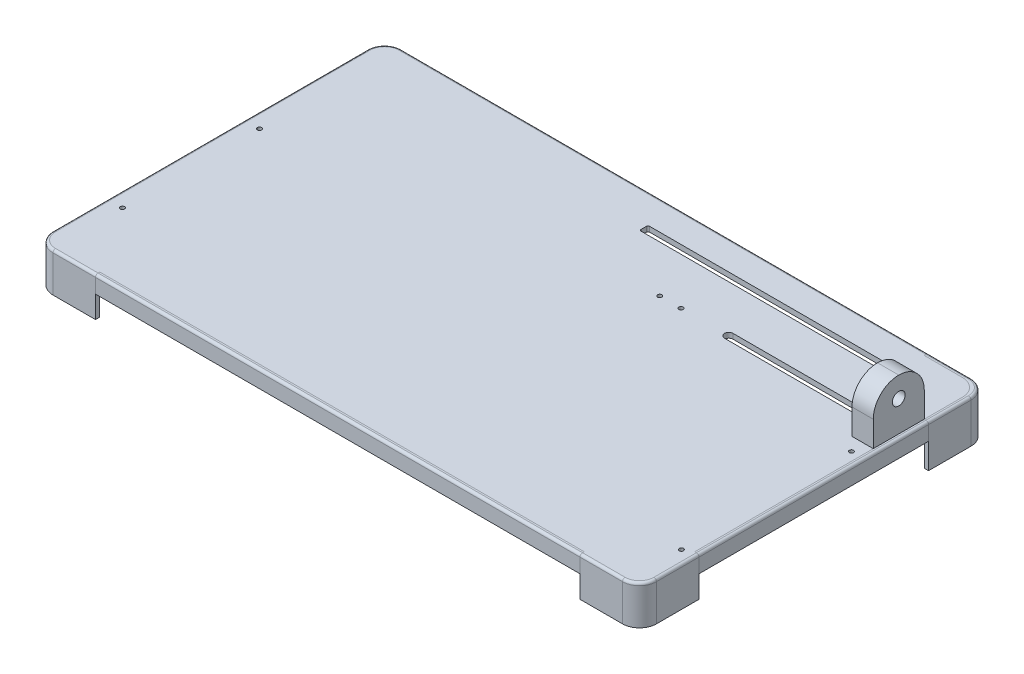
from build123d import *

# Parameters (mm, degrees)
SKETCH1_W                         = 700
SKETCH1_H                         = 400
BOSS_EXTRUDE1_DEPTH               = 6
SKETCH3_W                         = 310
SKETCH3_H                         = 10
CUT_EXTRUDE1_DEPTH                = 26
FILLET1_R                         = 2
FILLET2_R                         = 20
BOSS_EXTRUDE2_START               = -6
BOSS_EXTRUDE2_DEPTH               = 46
BOSS_EXTRUDE3_DEPTH               = 50
SKETCH10_W                        = 570
SKETCH10_H                        = 5
BOSS_EXTRUDE4_DEPTH               = 20
SKETCH11_W                        = 5
SKETCH11_H                        = 270
BOSS_EXTRUDE5_DEPTH               = 20
LPATTERN1_COUNT                   = 2
LPATTERN1_PITCH                   = 405
LPATTERN2_COUNT                   = 2
LPATTERN2_PITCH                   = 705
FILLET3_R                         = 3
FILLET4_R                         = 3
FILLET5_R                         = 3
FILLET6_R                         = 3
FILLET7_R                         = 3
F_5_0_5_DIAMETER_HOLE1_AT_2_COUNT = 2
F_5_0_5_DIAMETER_HOLE1_AT_2_PITCH = 25
SKETCH14_W                        = 25
SKETCH14_H                        = 60
BOSS_EXTRUDE6_DEPTH               = 60
FILLET8_R                         = 30
CUT_EXTRUDE2_DEPTH                = 60
SKETCH16_R                        = 7.5
CUT_EXTRUDE3_DEPTH                = 40
F_5_0_5_DIAMETER_HOLE2_AT_2_COUNT = 2
F_5_0_5_DIAMETER_HOLE2_AT_2_PITCH = 200
F_5_0_5_DIAMETER_HOLE3_AT_2_COUNT = 2
F_5_0_5_DIAMETER_HOLE3_AT_2_PITCH = 161.29


with BuildPart() as part:
    # Sketch1 → Boss-Extrude1 (new body)
    with BuildSketch(Plane(origin=(0, 0, 0), x_dir=(1, 0, 0), z_dir=(0, 1, 0))):
        Rectangle(SKETCH1_W, SKETCH1_H)
    extrude(amount=BOSS_EXTRUDE1_DEPTH)

    # Sketch3 → Cut-Extrude1 (cut)
    with BuildSketch(Plane(origin=(0, 6, 0), x_dir=(-1, 0, 0), z_dir=(0, 1, 0))):
        with Locations((-145, -165)):
            Rectangle(SKETCH3_W, SKETCH3_H)
    extrude(amount=-CUT_EXTRUDE1_DEPTH, mode=Mode.SUBTRACT)

    # Fillet1
    fillet1_edges = [part.edges().sort_by_distance(p)[0] for p in [
        (-10, 3, -160),
        (-10, 3, -170),
        (300, 3, -170),
        (300, 3, -160),
    ]]
    fillet(fillet1_edges, radius=FILLET1_R)

    # Fillet2
    fillet2_edges = [part.edges().sort_by_distance(p)[0] for p in [
        (-350, 3, -200),
        (350, 3, -200),
        (350, 3, 200),
        (-350, 3, 200),
    ]]
    fillet(fillet2_edges, radius=FILLET2_R)


with BuildPart() as body_2:
    # Sketch8 → Boss-Extrude2 (new body)
    with BuildSketch(Plane.XZ.offset(BOSS_EXTRUDE2_START)):
        with BuildLine():
            Line((-355, 135), (-355, 185))
            ThreePointArc((-355, 185), (-349.142135624, 199.142135624), (-335, 205))
            Line((-335, 205), (-285, 205))
            Line((-285, 205), (-285, 200))
            Line((-285, 200), (-330, 200))
            ThreePointArc((-330, 200), (-344.142135624, 194.142135624), (-350, 180))
            Line((-350, 180), (-350, 135))
            Line((-350, 135), (-355, 135))
        make_face()
    boss_extrude2 = extrude(amount=BOSS_EXTRUDE2_DEPTH)


with BuildPart() as part_1:
    add(part.part)

    # Mirror3: Boss-Extrude2 across plane
    add(boss_extrude2.mirror(Plane.XY))

    # Mirror6: Boss-Extrude2 across plane
    add(boss_extrude2.mirror(Plane(origin=(0, 0, 0), x_dir=(0, 0, 1), z_dir=(1, 0, 0))))


with BuildPart() as body_3:
    # Sketch9 → Boss-Extrude3 (new body)
    with BuildSketch(Plane(origin=(0, 6, 0), x_dir=(-1, 0, 0), z_dir=(0, 1, 0))):
        with BuildLine():
            Line((-355, -135), (-355, -185))
            ThreePointArc((-355, -185), (-349.142135624, -199.142135624), (-335, -205))
            Line((-335, -205), (-285, -205))
            Line((-285, -205), (-285, -200))
            Line((-285, -200), (-330, -200))
            ThreePointArc((-330, -200), (-344.142135624, -194.142135624), (-350, -180))
            Line((-350, -180), (-350, -135))
            Line((-350, -135), (-355, -135))
        make_face()
    extrude(amount=-BOSS_EXTRUDE3_DEPTH)

    # Fillet6
    fillet6_edges = [body_3.edges().sort_by_distance(p)[0] for p in [
        (355, 6, -160),
        (310, 6, -205),
        (349.142135624, 6, -199.142135624),
    ]]
    fillet(fillet6_edges, radius=FILLET6_R)


with BuildPart() as body_4:
    # Sketch10 → Boss-Extrude4 (new body)
    with BuildSketch(Plane(origin=(0, 6, 0), x_dir=(-1, 0, 0), z_dir=(0, 1, 0))):
        with Locations((0, 202.5)):
            Rectangle(SKETCH10_W, SKETCH10_H)
    boss_extrude4 = extrude(amount=-BOSS_EXTRUDE4_DEPTH)

    # Fillet3
    fillet3_edges = [body_4.edges().sort_by_distance(p)[0] for p in [
        (0, 6, 205),
    ]]
    fillet(fillet3_edges, radius=FILLET3_R)


with BuildPart() as body_5:
    # Sketch11 → Boss-Extrude5 (new body)
    with BuildSketch(Plane(origin=(0, 6, 0), x_dir=(-1, 0, 0), z_dir=(0, 1, 0))):
        with Locations((-352.5, 0)):
            Rectangle(SKETCH11_W, SKETCH11_H)
    boss_extrude5 = extrude(amount=-BOSS_EXTRUDE5_DEPTH)

    # Fillet4
    fillet4_edges = [body_5.edges().sort_by_distance(p)[0] for p in [
        (355, 6, 0),
    ]]
    fillet(fillet4_edges, radius=FILLET4_R)


with BuildPart() as part_2:
    add(part_1.part)

    # LPattern1: Boss-Extrude4 ×2
    with Locations(*[(0, 0, -i * LPATTERN1_PITCH) for i in range(1, LPATTERN1_COUNT)]):
        add(boss_extrude4)

    add(body_2.part)  # LPattern2 merges body 2
    # LPattern2: Boss-Extrude5 ×2
    with Locations(*[(-i * LPATTERN2_PITCH, 0, 0) for i in range(1, LPATTERN2_COUNT)]):
        add(boss_extrude5)

    # Fillet5
    fillet5_edges = [part_2.edges().sort_by_distance(p)[0] for p in [
        (310, 6, 205),
        (349.142135624, 6, 199.142135624),
        (355, 6, 160),
    ]]
    fillet(fillet5_edges, radius=FILLET5_R)

    # Fillet7
    fillet7_edges = [part_2.edges().sort_by_distance(p)[0] for p in [
        (-310, 6, 205),
        (-349.142135624, 6, 199.142135624),
        (-355, 6, 0),
        (-25, 6, -205),
        (-349.142135624, 6, -199.142135624),
    ]]
    fillet(fillet7_edges, radius=FILLET7_R)

    # Sketch12 → Ø5.0 (5) Diameter Hole1 (revolve, cut)
    with BuildSketch(Plane(origin=(68.81, 6, -105), x_dir=(0, 0, 1), z_dir=(1, 0, 0))):
        Polygon((0, 0), (0, 12.502151548), (2.5, 11), (2.5, 0), align=None)
    f_5_0_5_diameter_hole1 = revolve(axis=Axis((68.81, 12.35, -105), (0, -1, 0)), mode=Mode.SUBTRACT)

    # Ø5.0 (5) Diameter Hole1 at 2: Ø5.0 (5) Diameter Hole1 ×2
    with Locations(*[(i * F_5_0_5_DIAMETER_HOLE1_AT_2_PITCH, 0, 0) for i in range(1, F_5_0_5_DIAMETER_HOLE1_AT_2_COUNT)]):
        add(f_5_0_5_diameter_hole1, mode=Mode.SUBTRACT)

    # Sketch15 → Cut-Extrude2 (cut)
    with BuildSketch(Plane(origin=(0, 6, 0), x_dir=(-1, 0, 0), z_dir=(0, 1, 0))):
        with BuildLine():
            Line((-150, -110), (-300, -110))
            ThreePointArc((-300, -110), (-305, -105), (-300, -100))
            Line((-300, -100), (-150, -100))
            ThreePointArc((-150, -100), (-145, -105), (-150, -110))
        make_face()
    extrude(amount=-CUT_EXTRUDE2_DEPTH, mode=Mode.SUBTRACT)

    # Sketch17 → Ø5.0 (5) Diameter Hole2 (revolve, cut)
    with BuildSketch(Plane(origin=(340, 6, 140.67), x_dir=(0, 0, 1), z_dir=(1, 0, 0))):
        Polygon((0, 0), (0, 12.502151548), (2.5, 11), (2.5, 0), align=None)
    f_5_0_5_diameter_hole2 = revolve(axis=Axis((340, 12.35, 140.67), (0, -1, 0)), mode=Mode.SUBTRACT)

    # Ø5.0 (5) Diameter Hole2 at 2: Ø5.0 (5) Diameter Hole2 ×2
    with Locations(*[(0, 0, -i * F_5_0_5_DIAMETER_HOLE2_AT_2_PITCH) for i in range(1, F_5_0_5_DIAMETER_HOLE2_AT_2_COUNT)]):
        add(f_5_0_5_diameter_hole2, mode=Mode.SUBTRACT)

    # Sketch19 → Ø5.0 (5) Diameter Hole3 (revolve, cut)
    with BuildSketch(Plane(origin=(-337, 6, -40), x_dir=(0, 0, 1), z_dir=(1, 0, 0))):
        Polygon((0, 0), (0, 12.502151548), (2.5, 11), (2.5, 0), align=None)
    f_5_0_5_diameter_hole3 = revolve(axis=Axis((-337, 12.35, -40), (0, -1, 0)), mode=Mode.SUBTRACT)

    # Ø5.0 (5) Diameter Hole3 at 2: Ø5.0 (5) Diameter Hole3 ×2
    with Locations(*[(0, 0, i * F_5_0_5_DIAMETER_HOLE3_AT_2_PITCH) for i in range(1, F_5_0_5_DIAMETER_HOLE3_AT_2_COUNT)]):
        add(f_5_0_5_diameter_hole3, mode=Mode.SUBTRACT)


with BuildPart() as body_5_2:
    # Sketch14 → Boss-Extrude6 (new body)
    with BuildSketch(Plane(origin=(0, 6, 0), x_dir=(-1, 0, 0), z_dir=(0, 1, 0))):
        with Locations((-337.5, -105)):
            Rectangle(SKETCH14_W, SKETCH14_H)
    extrude(amount=BOSS_EXTRUDE6_DEPTH)

    # Fillet8
    fillet8_edges = [body_5_2.edges().sort_by_distance(p)[0] for p in [
        (337.5, 66, -135),
        (337.5, 66, -75),
    ]]
    fillet(fillet8_edges, radius=FILLET8_R - 0.0001)  # a hair under: the kernel refuses the full size

    # Sketch16 → Cut-Extrude3 (cut)
    with BuildSketch(Plane(origin=(350, 0, 0), x_dir=(0, 0, -1), z_dir=(1, 0, 0))):
        with Locations((105, 42)):
            Circle(SKETCH16_R)
    extrude(amount=-CUT_EXTRUDE3_DEPTH, mode=Mode.SUBTRACT)


solid = Compound([body_3.part, body_4.part, body_5.part, part_2.part, body_5_2.part])
